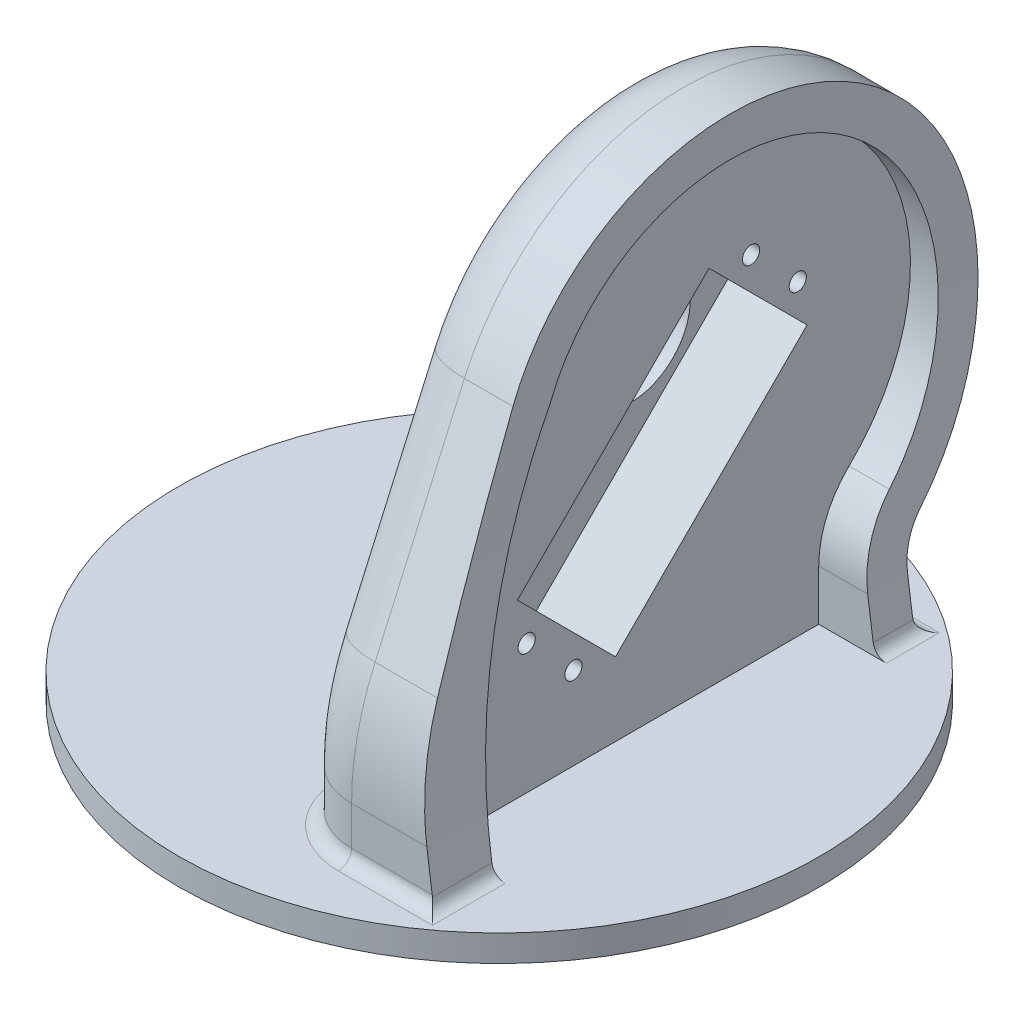
from build123d import *

# Parameters (mm, degrees)
SKETCH1_R                       = 48.5
SKETCH1_R_2                     = 1.5
BOSS_EXTRUDE3_DEPTH             = 4
BOSS_EXTRUDE4_START             = 4
SKETCH3_R                       = 9
BOSS_EXTRUDE4_DEPTH             = 14
CUT_EXTRUDE2_START              = 6
SKETCH5_R                       = 1.3
CUT_EXTRUDE2_DEPTH              = 96.333743786
BOSS_EXTRUDE5_DEPTH             = 9
BOSS_EXTRUDE5_DIRECTION_2_REACH = 113.079
CUT_EXTRUDE3_DEPTH              = 107.628687584
CUT_EXTRUDE3_DEPTH_BACK         = 107.628687584
FILLET1_R                       = 10
FILLET2_R                       = 2
SKETCH11_R                      = 3.75
CUT_EXTRUDE4_DEPTH              = 2.6


with BuildPart() as part:
    # Sketch1 → Boss-Extrude3 (new body)
    with BuildSketch(Plane(origin=(0, 0, 0), x_dir=(1, 0, 0), z_dir=(0, 1, 0))):
        with Locations(Location((0, 0, 0), (0, 0, 270))):
            Circle(SKETCH1_R)
        with Locations(Location((0, 7.25, 0), (0, 0, 270))):
            Circle(SKETCH1_R_2, mode=Mode.SUBTRACT)
        with Locations(Location((0, -7.25, 0), (0, 0, 270))):
            Circle(SKETCH1_R_2, mode=Mode.SUBTRACT)
    extrude(amount=BOSS_EXTRUDE3_DEPTH)

    # Sketch3 → Boss-Extrude4 (add)
    with BuildSketch(Plane(origin=(0, 0, 0), x_dir=(0, 0, -1), z_dir=(1, 0, 0)).offset(BOSS_EXTRUDE4_START)):
        with BuildLine():
            Line((30.34, 4), (-30.34, 4))
            Line((-30.34, 4), (-30.34, 11.86))
            ThreePointArc((-30.34, 11.86), (-29.573286886, 19.169908139), (-27.306519614, 26.161644128))
            Line((-27.306519614, 26.161644128), (-13.792358873, 56.58534489))
            ThreePointArc((-13.792358873, 56.58534489), (31.303559207, 69.105517077), (34.935565542, 22.444986978))
            ThreePointArc((34.935565542, 22.444986978), (31.536621485, 17.510838233), (30.34, 11.64))
            Line((30.34, 11.64), (30.34, 4))
        make_face()
        with Locations((13.91, 44.28)):
            Circle(SKETCH3_R, mode=Mode.SUBTRACT)
    extrude(amount=BOSS_EXTRUDE4_DEPTH)

    # Sketch5 → Cut-Extrude2 (cut, through all)
    with BuildSketch(Plane(origin=(0, 0, 0), x_dir=(0, 0, -1), z_dir=(1, 0, 0)).offset(CUT_EXTRUDE2_START)):
        with Locations(Location((27.167164466, 50.465339059, 0), (0, 0, 180))):
            Circle(SKETCH5_R)
        with Locations(Location((20.096096654, 57.536406871, 0), (0, 0, 180))):
            Circle(SKETCH5_R)
        with Locations(Location((-6.773961031, 16.524213562, 0), (0, 0, 180))):
            Circle(SKETCH5_R)
        with Locations(Location((-13.845028843, 23.595281374, 0), (0, 0, 180))):
            Circle(SKETCH5_R)
        Polygon((-0.41, 15.11), (28.581378029, 44.101378029), (13.732135624, 58.950620434), (-15.259242405, 29.959242405), align=None)
    extrude(amount=CUT_EXTRUDE2_DEPTH, mode=Mode.SUBTRACT)

    # Sketch9 → Boss-Extrude5 (add)
    with BuildSketch(Plane(origin=(18, 0, 0), x_dir=(0, 0, -1), z_dir=(1, 0, 0))):
        with BuildLine():
            Line((30.34, 4), (30.34, 11.64))
            ThreePointArc((30.34, 11.64), (31.536621485, 17.510838233), (34.935565542, 22.444986978))
            ThreePointArc((34.935565542, 22.444986978), (31.303559207, 69.105517077), (-13.792358873, 56.58534489))
            ThreePointArc((-13.792358873, 56.58534489), (-24.20389685, 31.229863028), (-27.34, 4))
            Line((-27.34, 4), (-36.34, 4))
            Line((-36.34, 4), (-36.34, 11.86))
            ThreePointArc((-36.34, 11.86), (-35.442708439, 20.414854175), (-32.789889403, 28.597348492))
            Line((-32.789889403, 28.597348492), (-19.275728663, 59.021049255))
            ThreePointArc((-19.275728663, 59.021049255), (34.746418262, 74.019448449), (39.097339325, 18.122992187))
            ThreePointArc((39.097339325, 18.122992187), (37.057972891, 15.16250294), (36.34, 11.64))
            Line((36.34, 11.64), (36.34, 4))
            Line((36.34, 4), (30.34, 4))
        make_face()
    extrude(amount=BOSS_EXTRUDE5_DEPTH)

    # Boss-Extrude5 direction 2: up to this face of the body (flat: up to its plane)
    boss_extrude5_direction_2_end = Plane(part.part.faces().sort_by_distance((4, 35.761181815, -7.797700276))[0])
    # Sketch9 → Boss-Extrude5 direction 2 (add, up to the picked face)
    with BuildSketch(Plane(origin=(18, 0, 0), x_dir=(0, 0, -1), z_dir=(1, 0, 0)), mode=Mode.PRIVATE) as boss_extrude5_direction_2_sk1:
        with BuildLine():
            Line((30.34, 4), (30.34, 11.64))
            ThreePointArc((30.34, 11.64), (31.536621485, 17.510838233), (34.935565542, 22.444986978))
            ThreePointArc((34.935565542, 22.444986978), (31.303559207, 69.105517077), (-13.792358873, 56.58534489))
            ThreePointArc((-13.792358873, 56.58534489), (-24.20389685, 31.229863028), (-27.34, 4))
            Line((-27.34, 4), (-36.34, 4))
            Line((-36.34, 4), (-36.34, 11.86))
            ThreePointArc((-36.34, 11.86), (-35.442708439, 20.414854175), (-32.789889403, 28.597348492))
            Line((-32.789889403, 28.597348492), (-19.275728663, 59.021049255))
            ThreePointArc((-19.275728663, 59.021049255), (34.746418262, 74.019448449), (39.097339325, 18.122992187))
            ThreePointArc((39.097339325, 18.122992187), (37.057972891, 15.16250294), (36.34, 11.64))
            Line((36.34, 11.64), (36.34, 4))
            Line((36.34, 4), (30.34, 4))
        make_face()
    boss_extrude5_direction_2_tool1 = split(extrude(boss_extrude5_direction_2_sk1.sketch, amount=-BOSS_EXTRUDE5_DIRECTION_2_REACH, mode=Mode.PRIVATE), bisect_by=boss_extrude5_direction_2_end, keep=Keep.BOTH, mode=Mode.PRIVATE)
    add(boss_extrude5_direction_2_tool1.solids().sort_by(Axis((18, 43.339989, 24.976501), (-1, 0, 0)))[0])

    # Sketch10 → Cut-Extrude3 (cut, two sides: drawn at the far end of the back side and taken through both)
    with BuildSketch(Plane.XY.offset(-CUT_EXTRUDE3_DEPTH_BACK)):
        with BuildLine():
            Line((27, 80.59241), (21, 80.59241))
            ThreePointArc((21, 80.59241), (22.277450308, 42.190463148), (26.5, 4))
            Line((26.5, 4), (27, 4))
            Line((27, 4), (27, 80.59241))
        make_face()
    extrude(amount=CUT_EXTRUDE3_DEPTH + CUT_EXTRUDE3_DEPTH_BACK, mode=Mode.SUBTRACT)

    # Fillet1
    # the kernel refuses this fillet: 10 mm, written as the material it takes off along each edge
    with BuildSketch(Plane(origin=(4, 11.64, -36.34), x_dir=(0, 0, 1), z_dir=(0, -1, 0))) as fillet1_piece_1:
        with BuildLine():
            CenterArc((FILLET1_R, -FILLET1_R), FILLET1_R, 90, 90)
            Line((0, -FILLET1_R), (0, 0))
            Line((0, 0), (FILLET1_R, 0))
        make_face()
    extrude(amount=7.64, mode=Mode.SUBTRACT)
    with BuildSketch(Plane(origin=(4, 11.64, -45.34), x_dir=(0, 0.7203324652134895, 0.6936289638988969), z_dir=(0, 0.6936289638988969, -0.7203324652134895))) as fillet1_piece_2:
        with BuildLine():
            CenterArc((9 + FILLET1_R, FILLET1_R), FILLET1_R, 180, 90)
            Line((9, FILLET1_R), (9, 0))
            Line((9, 0), (9 + FILLET1_R, 0))
        make_face()
    revolve(axis=Axis((4, 11.64, -45.34), (1, 0, 0)), revolution_arc=46.081936205, mode=Mode.SUBTRACT)
    with BuildSketch(Plane(origin=(4, 44.28, -13.91), x_dir=(0, -0.7203324652134897, -0.6936289638988965), z_dir=(0, -0.6936289638988965, 0.7203324652134897))) as fillet1_piece_3:
        with BuildLine():
            CenterArc((36.31241 - FILLET1_R, FILLET1_R), FILLET1_R, 270, 90)
            Line((36.31241, FILLET1_R), (36.31241, 0))
            Line((36.31241, 0), (36.31241 - FILLET1_R, 0))
        make_face()
    revolve(axis=Axis((4, 44.28, -13.91), (1, 0, 0)), revolution_arc=202.131217863, mode=Mode.SUBTRACT)
    with BuildSketch(Plane(origin=(4, 28.597348492, 32.789889403), x_dir=(0, -0.40595072743967076, -0.913894964911834), z_dir=(0, 0.913894964911834, -0.4059507274396708))) as fillet1_piece_4:
        with BuildLine():
            CenterArc((FILLET1_R, -FILLET1_R), FILLET1_R, 90, 90)
            Line((0, -FILLET1_R), (0, 0))
            Line((0, 0), (FILLET1_R, 0))
        make_face()
    extrude(amount=33.290150324, mode=Mode.SUBTRACT)
    with BuildSketch(Plane(origin=(4, 11.86, -4.89), x_dir=(0, 0.4059507274396698, 0.9138949649118343), z_dir=(0, 0.9138949649118343, -0.4059507274396698))) as fillet1_piece_5:
        with BuildLine():
            CenterArc((41.23 - FILLET1_R, FILLET1_R), FILLET1_R, 270, 90)
            Line((41.23, FILLET1_R), (41.23, 0))
            Line((41.23, 0), (41.23 - FILLET1_R, 0))
        make_face()
    revolve(axis=Axis((4, 11.86, -4.89), (1, 0, 0)), revolution_arc=23.950718343, mode=Mode.SUBTRACT)
    with BuildSketch(Plane(origin=(4, 4, 36.34), x_dir=(0, 0, -1), z_dir=(0, 1, 0))) as fillet1_piece_6:
        with BuildLine():
            CenterArc((FILLET1_R, -FILLET1_R), FILLET1_R, 90, 90)
            Line((0, -FILLET1_R), (0, 0))
            Line((0, 0), (FILLET1_R, 0))
        make_face()
    extrude(amount=7.86, mode=Mode.SUBTRACT)

    # Fillet2
    fillet2_edges = [part.edges().sort_by_distance(p)[0] for p in [
        (20.25, 4, -36.34),
        (20.25, 4, 36.34),
        (6.928932188, 4, 33.411067812),
        (4, 4, 0),
        (6.928932188, 4, -33.411067812),
    ]]
    fillet(fillet2_edges, radius=FILLET2_R)
    fillet2_2_edges = [part.edges().sort_by_distance(p)[0] for p in [
        (26.5, 4, -33.34),
    ]]
    fillet(fillet2_2_edges, radius=FILLET2_R)
    fillet2_3_edges = [part.edges().sort_by_distance(p)[0] for p in [
        (26.5, 4, 31.84),
    ]]
    fillet(fillet2_3_edges, radius=FILLET2_R)

    # Sketch11 → Cut-Extrude4 (cut)
    with BuildSketch(Plane.XZ):
        with Locations(Location((0, 0, 0), (0, 0, 270))):
            Circle(SKETCH11_R)
    extrude(amount=-CUT_EXTRUDE4_DEPTH, mode=Mode.SUBTRACT)


solid = part.part
